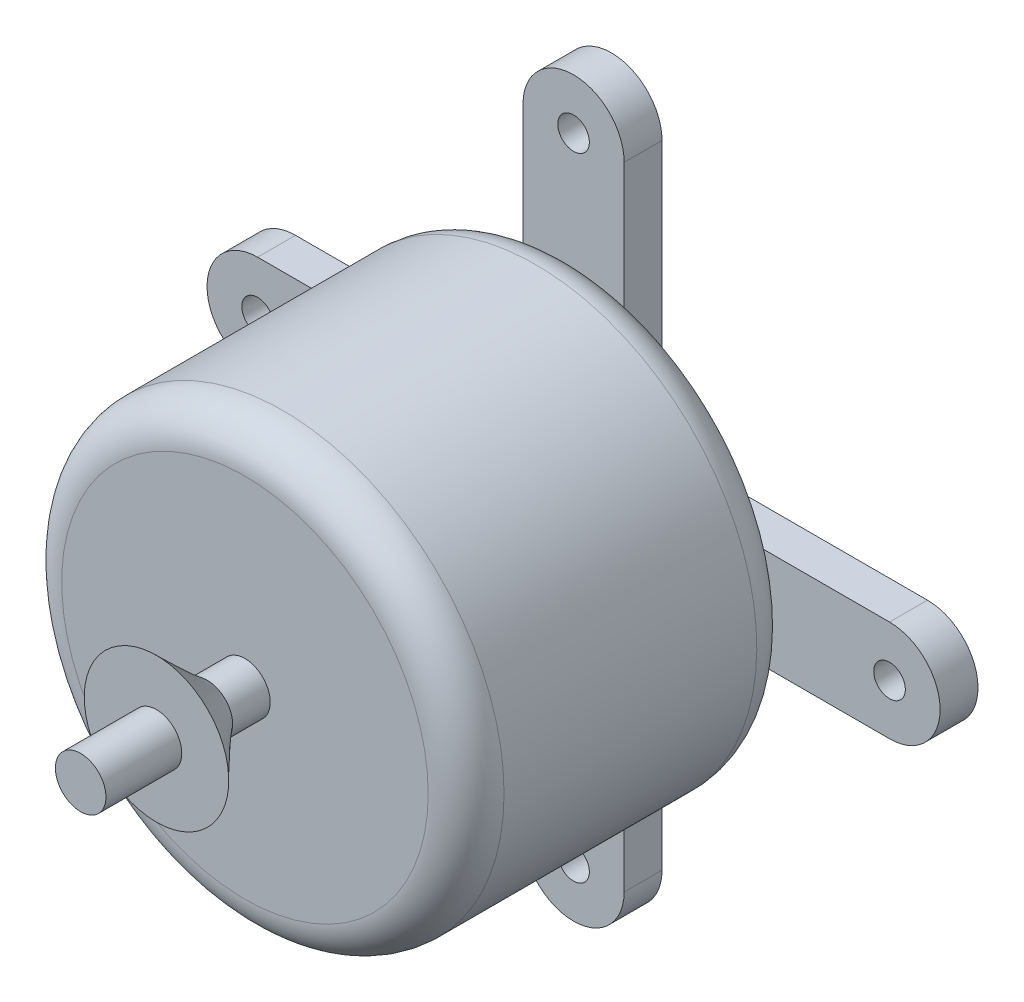
from build123d import *

# Parameters (mm, degrees)
ESQUISSE1_R             = 17.5
BOSS_EXTRU_1_DEPTH      = 26
CONG_1_R                = 3
ESQUISSE2_R             = 2
BOSS_EXTRU_2_DEPTH      = 20
ESQUISSE3_R             = 2.5
BOSS_EXTRU_3_DEPTH      = 5
CONG_5_R                = 1
ESQUISSE6_R             = 4.037593864
ENL_V_MAT_EXTRU_1_DEPTH = 7
ESQUISSE7_R             = 1.25
BOSS_EXTRU_4_DEPTH      = 3
ESQUISSE9_R             = 1.25
BOSS_EXTRU_5_DEPTH      = 3
ESQUISSE10_R            = 1.25
BOSS_EXTRU_6_DEPTH      = 3
ESQUISSE11_R            = 1.25
BOSS_EXTRU_7_DEPTH      = 3
ESQUISSE12_R            = 7.076094554
ENL_V_MAT_EXTRU_3_DEPTH = 32


with BuildPart() as part:
    # Esquisse1 → Boss.-Extru.1 (new body)
    with BuildSketch(Plane.XY):
        with Locations(Location((0, 0, 0), (0, 0, 180))):
            Circle(ESQUISSE1_R)
    extrude(amount=BOSS_EXTRU_1_DEPTH)

    # Congé1
    cong_1_edges = [part.edges().sort_by_distance(p)[0] for p in [
        (17.5, 0, 0),
        (17.5, 0, 26),
    ]]
    fillet(cong_1_edges, radius=CONG_1_R)

    # Esquisse2 → Boss.-Extru.2 (add)
    with BuildSketch(Plane.XY.offset(26)):
        Circle(ESQUISSE2_R)
    extrude(amount=BOSS_EXTRU_2_DEPTH)

    # Esquisse3 → Boss.-Extru.3 (add)
    with BuildSketch(Plane(origin=(0, 0, 0), x_dir=(-1, 0, 0), z_dir=(0, 0, -1))):
        with Locations(Location((0, 0, 0), (0, 0, 180))):
            Circle(ESQUISSE3_R)
    extrude(amount=BOSS_EXTRU_3_DEPTH)

    # Congé5
    cong_5_edges = [part.edges().sort_by_distance(p)[0] for p in [
        (-2.5, 0, -5),
    ]]
    fillet(cong_5_edges, radius=CONG_5_R)

    # Lissage1: read off the stored shape, not the designer's step
    # Lissage1: loft between two sections, ruled curve by curve
    lissage1_from = [
        Edge.make_bspline([(-1.703307527, 1.048209649, 26), (-3.799726825, -2.358405406, 26), (-0.39311177, -4.454824703, 26), (1.703307527, -1.048209649, 26), (3.799726825, 2.358405406, 26), (0.39311177, 4.454824703, 26), (-1.703307527, 1.048209649, 26)], [0, 0, 0, 0, 0.5, 0.5, 0.5, 1, 1, 1, 1], 3, [1, 0.333333333, 0.333333333, 1, 0.333333333, 0.333333333, 1]),
    ]
    lissage1_to = [
        Edge.make_bspline([(5.264402681, 2.231137224, 33), (0.802128233, 12.759942587, 33), (-9.72667713, 8.297668139, 33), (-5.264402681, -2.231137224, 33), (-0.802128233, -12.759942587, 33), (9.72667713, -8.297668139, 33), (5.264402681, 2.231137224, 33)], [0, 0, 0, 0, 0.5, 0.5, 0.5, 1, 1, 1, 1], 3, [1, 0.333333333, 0.333333333, 1, 0.333333333, 0.333333333, 1]),
    ]
    lissage1 = Solid(Shell([*[Face.make_surface_from_curves(lissage1_from[k], lissage1_to[k]) for k in range(1)], Face(Wire(lissage1_from)), Face(Wire(lissage1_to))]))
    add(lissage1)

    # Esquisse6 → Enlèv. mat.-Extru.1 (cut)
    with BuildSketch(Plane.XY.offset(46)):
        Circle(ESQUISSE6_R)
    extrude(amount=-ENL_V_MAT_EXTRU_1_DEPTH, mode=Mode.SUBTRACT)

    # Esquisse7 → Boss.-Extru.4 (add)
    with BuildSketch(Plane(origin=(0, 0, 0), x_dir=(-1, 0, 0), z_dir=(0, 0, -1))):
        with BuildLine():
            Line((4, 0), (4, -25))
            ThreePointArc((4, -25), (0, -29), (-4, -25))
            Line((-4, -25), (-4, 0))
            ThreePointArc((-4, 0), (0, 4), (4, 0))
        make_face()
        with Locations((0, -25)):
            Circle(ESQUISSE7_R, mode=Mode.SUBTRACT)
    extrude(amount=BOSS_EXTRU_4_DEPTH)

    # Esquisse9 → Boss.-Extru.5 (add)
    with BuildSketch(Plane(origin=(0, 0, 0), x_dir=(-1, 0, 0), z_dir=(0, 0, -1))):
        with BuildLine():
            Line((-4, 0), (-4, 25))
            ThreePointArc((-4, 25), (0, 29), (4, 25))
            Line((4, 25), (4, 0))
            ThreePointArc((4, 0), (0, -4), (-4, 0))
        make_face()
        with Locations((0, 25)):
            Circle(ESQUISSE9_R, mode=Mode.SUBTRACT)
    extrude(amount=BOSS_EXTRU_5_DEPTH)

    # Esquisse10 → Boss.-Extru.6 (add)
    with BuildSketch(Plane(origin=(0, 0, 0), x_dir=(-1, 0, 0), z_dir=(0, 0, -1))):
        with BuildLine():
            Line((0, -4), (-25, -4))
            ThreePointArc((-25, -4), (-29, 0), (-25, 4))
            Line((-25, 4), (0, 4))
            ThreePointArc((0, 4), (4, 0), (0, -4))
        make_face()
        with Locations((-25, 0)):
            Circle(ESQUISSE10_R, mode=Mode.SUBTRACT)
    extrude(amount=BOSS_EXTRU_6_DEPTH)

    # Esquisse11 → Boss.-Extru.7 (add)
    with BuildSketch(Plane(origin=(0, 0, 0), x_dir=(-1, 0, 0), z_dir=(0, 0, -1))):
        with BuildLine():
            Line((0, 4), (25, 4))
            ThreePointArc((25, 4), (29, 0), (25, -4))
            Line((25, -4), (0, -4))
            ThreePointArc((0, -4), (-4, 0), (0, 4))
        make_face()
        with Locations((25, 0)):
            Circle(ESQUISSE11_R, mode=Mode.SUBTRACT)
    extrude(amount=BOSS_EXTRU_7_DEPTH)

    # Esquisse12 → Enlèv. mat.-Extru.3 (cut)
    with BuildSketch(Plane(origin=(0, 0, -3), x_dir=(-1, 0, 0), z_dir=(0, 0, -1))):
        Circle(ESQUISSE12_R)
    extrude(amount=ENL_V_MAT_EXTRU_3_DEPTH, mode=Mode.SUBTRACT)


solid = part.part
